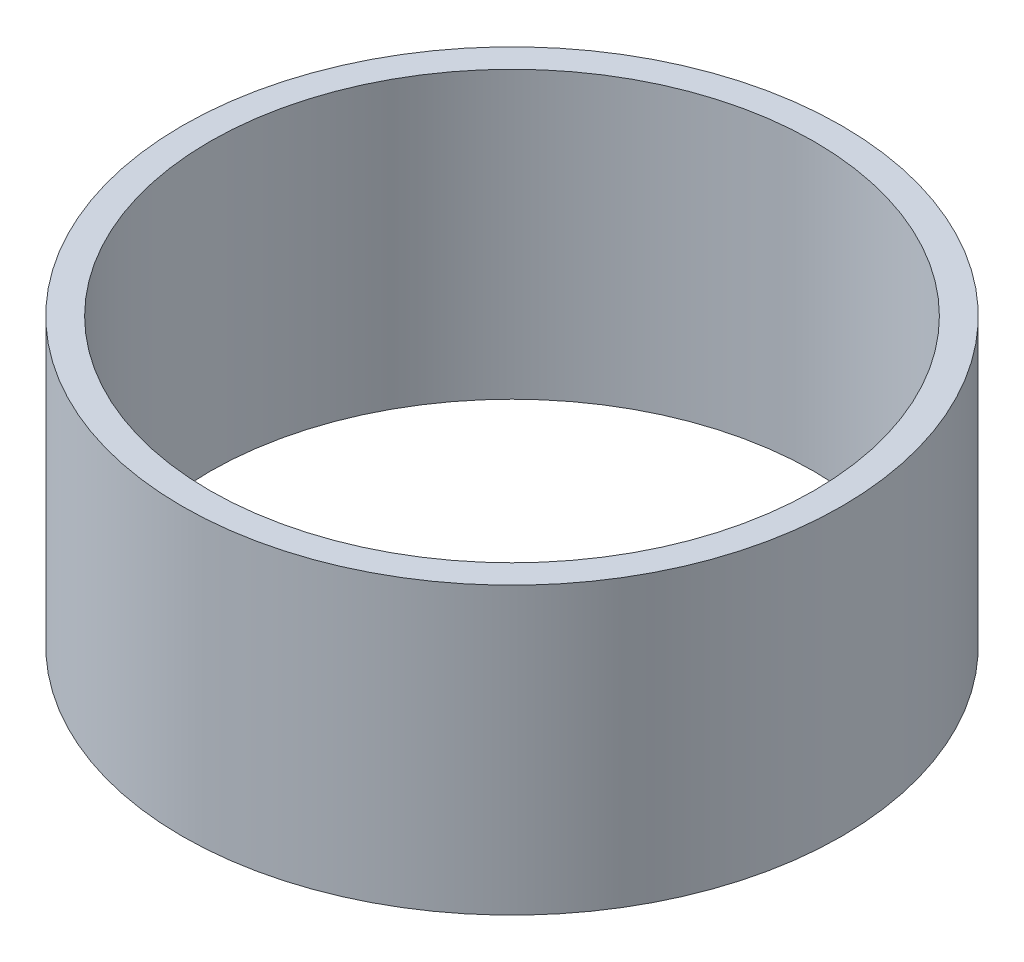
from build123d import *

# Parameters (mm, degrees)
SKETCH1_R           = 76.2
SKETCH1_R_2         = 69.85
BOSS_EXTRUDE1_DEPTH = 33.02


with BuildPart() as part:
    # Sketch1 → Boss-Extrude1 (new, symmetric)
    with BuildSketch(Plane(origin=(0, 0, 0), x_dir=(1, 0, 0), z_dir=(0, 1, 0))):
        Circle(SKETCH1_R)
        Circle(SKETCH1_R_2, mode=Mode.SUBTRACT)
    extrude(amount=BOSS_EXTRUDE1_DEPTH, both=True)


solid = part.part
